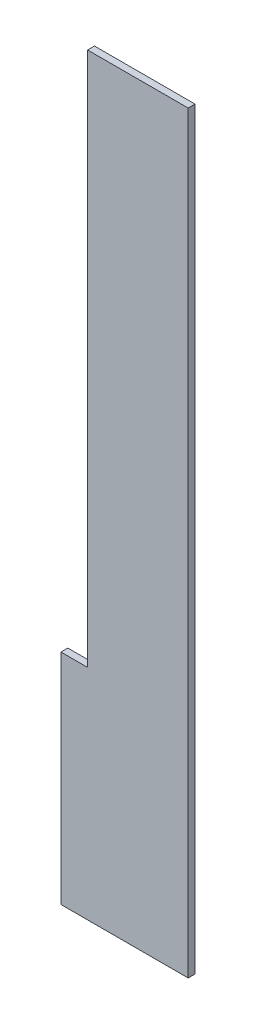
from build123d import *

# Parameters (mm, degrees)
TABAN_FLAN_1_DEPTH         = 40
KES_EKSTR_ZYON1_DEPTH      = 6158.209189235
KES_EKSTR_ZYON1_DEPTH_BACK = 6158.209189235
IZIM2_W                    = 1360
IZIM2_H                    = 355
KES_EKSTR_ZYON2_DEPTH      = 6158.209189235
KES_EKSTR_ZYON2_DEPTH_BACK = 6158.209189235
IZIM3_W                    = 365
IZIM3_H                    = 3110
IZIM3_W_2                  = 5
IZIM3_H_2                  = 5650
KES_EKSTR_ZYON3_DEPTH      = 6157.106724221
KES_EKSTR_ZYON3_DEPTH_BACK = 6157.106724221
IZIM4_W                    = 405
IZIM4_H                    = 3110
KES_EKSTR_ZYON4_DEPTH      = 6157.106724221
KES_EKSTR_ZYON4_DEPTH_BACK = 6157.106724221


# Sheet-metal steps are written as plain solids
with BuildPart() as part:
    # Çizim1 → Taban-Flanş1 (new body)
    with BuildSketch(Plane.XY):
        Polygon((0, 0), (0, -3465), (-660, -3465), (-660, -6005), (1360, -6005), (1360, 0), align=None)
    extrude(amount=-TABAN_FLAN_1_DEPTH)

    # Çizim2 → Kes-Ekstrüzyon1 (cut, two sides: drawn at the far end of the back side and taken through both)
    with BuildSketch(Plane.XY.offset(-KES_EKSTR_ZYON1_DEPTH_BACK)):
        with Locations((680, -177.5)):
            Rectangle(IZIM2_W, IZIM2_H)
    extrude(amount=KES_EKSTR_ZYON1_DEPTH + KES_EKSTR_ZYON1_DEPTH_BACK, mode=Mode.SUBTRACT)

    # Çizim3 → Kes-Ekstrüzyon2 (cut, two sides: drawn at the far end of the back side and taken through both)
    with BuildSketch(Plane.XY.offset(-KES_EKSTR_ZYON2_DEPTH_BACK)):
        with Locations((182.5, -1910)):
            Rectangle(IZIM3_W, IZIM3_H)
        with Locations((1357.5, -3180)):
            Rectangle(IZIM3_W_2, IZIM3_H_2)
    extrude(amount=KES_EKSTR_ZYON2_DEPTH + KES_EKSTR_ZYON2_DEPTH_BACK, mode=Mode.SUBTRACT)

    # Çizim4 → Kes-Ekstrüzyon3 (cut, two sides: drawn at the far end of the back side and taken through both)
    with BuildSketch(Plane.XY.offset(-KES_EKSTR_ZYON3_DEPTH_BACK)):
        with Locations((567.5, -1910)):
            Rectangle(IZIM4_W, IZIM4_H)
    extrude(amount=KES_EKSTR_ZYON3_DEPTH + KES_EKSTR_ZYON3_DEPTH_BACK, mode=Mode.SUBTRACT)

    # Çizim5 → Kes-Ekstrüzyon4 (cut, two sides: drawn at the far end of the back side and taken through both)
    with BuildSketch(Plane.XY.offset(-KES_EKSTR_ZYON4_DEPTH_BACK)):
        Polygon((615, -3465), (615, -4737), (1355, -4737), (1355, -6005), (-660, -6005), (-660, -3465), align=None)
    extrude(amount=KES_EKSTR_ZYON4_DEPTH + KES_EKSTR_ZYON4_DEPTH_BACK, mode=Mode.SUBTRACT)


solid = part.part
